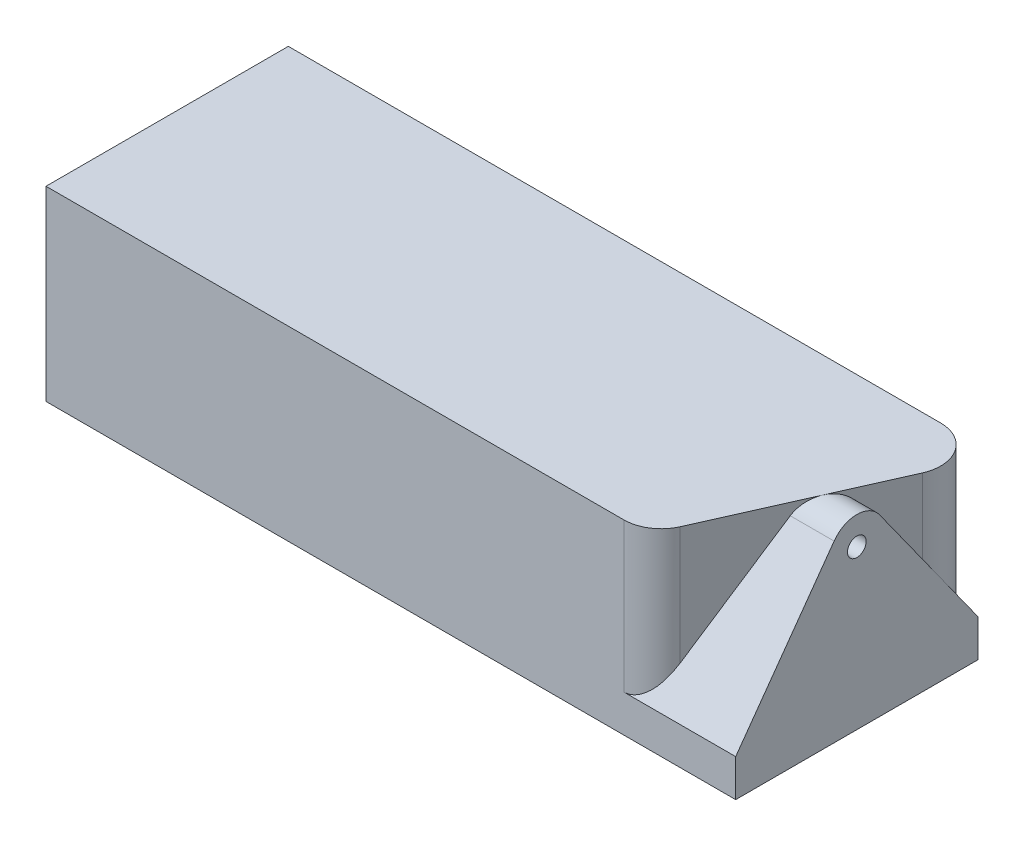
from build123d import *

# Parameters (mm, degrees)
BOSS_EXTRUDE1_DEPTH      = 15.875
BOSS_EXTRUDE2_DEPTH      = 10.31875
BOSS_EXTRUDE2_DEPTH_BACK = 10.31875
SKETCH3_R                = 0.79375
BOSS_EXTRUDE3_DEPTH      = 58.7375


with BuildPart() as part:
    # Sketch1 → Boss-Extrude1 (new body)
    with BuildSketch(Plane(origin=(0, 0, 0), x_dir=(1, 0, 0), z_dir=(0, 1, 0))):
        with BuildLine():
            Line((0, -10.31875), (0, 10.31875))
            Line((0, 10.31875), (55.5625, 10.31875))
            ThreePointArc((55.5625, 10.31875), (58.224712855, 8.873850492), (58.463851667, 5.85426037))
            Line((58.463851667, 5.85426037), (52.113851667, -8.43323963))
            ThreePointArc((52.113851667, -8.43323963), (50.942600492, -9.805962855), (49.2125, -10.31875))
            Line((49.2125, -10.31875), (0, -10.31875))
        make_face()
    extrude(amount=BOSS_EXTRUDE1_DEPTH)



with BuildPart() as body_2:
    # Sketch2 → Boss-Extrude2 (new, two sides: drawn at the far end of the back side and taken through both)
    with BuildSketch(Plane.XY.offset(-BOSS_EXTRUDE2_DEPTH_BACK)):
        Polygon((0, 0), (0, 3.175), (1.5875, 3.175), (1.5875, 15.875), (3.96875, 15.875), (3.96875, 3.175), (7.14375, 3.175), (7.14375, 15.875), (9.525, 15.875), (9.525, 3.175), (58.7375, 3.175), (58.7375, 0), align=None)
    extrude(amount=BOSS_EXTRUDE2_DEPTH + BOSS_EXTRUDE2_DEPTH_BACK)


with BuildPart() as part_1:
    add(part.part)

    add(body_2.part)  # Boss-Extrude3 merges body 2
    # Sketch3 → Boss-Extrude3 (add)
    with BuildSketch(Plane(origin=(0, 0, 0), x_dir=(0, 0, -1), z_dir=(1, 0, 0))):
        with BuildLine():
            Line((10.31875, 0), (-10.31875, 0))
            Line((-10.31875, 0), (-10.31875, 3.175))
            Line((-10.31875, 3.175), (-1.93598896, 14.880219729))
            ThreePointArc((-1.93598896, 14.880219729), (0, 15.875), (1.93598896, 14.880219729))
            Line((1.93598896, 14.880219729), (10.31875, 3.175))
            Line((10.31875, 3.175), (10.31875, 0))
        make_face()
        with Locations((0, 13.49375)):
            Circle(SKETCH3_R, mode=Mode.SUBTRACT)
    extrude(amount=BOSS_EXTRUDE3_DEPTH)


solid = part_1.part
